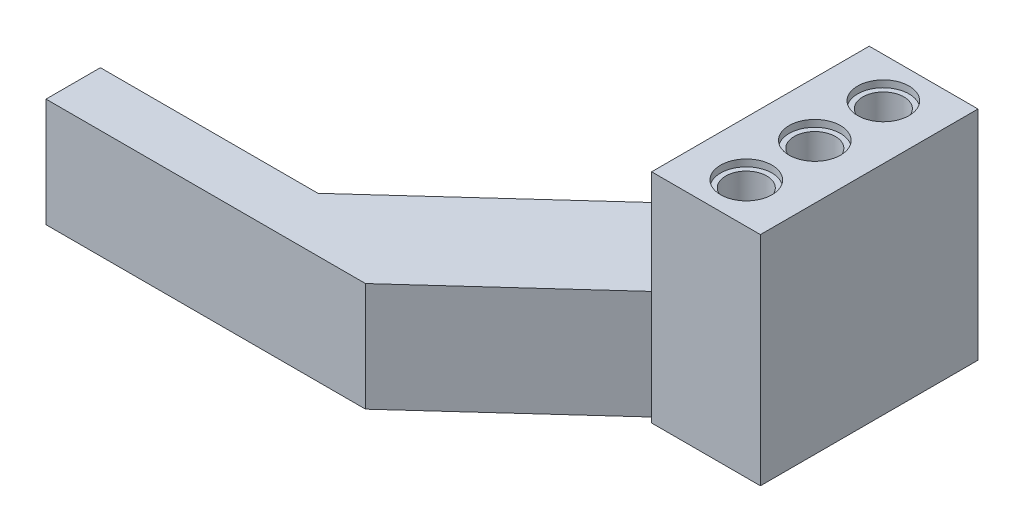
from build123d import *

# Parameters (mm, degrees)
SKETCH6_W           = 12.7
SKETCH6_H           = 25.4
BOSS_EXTRUDE1_DEPTH = 25.4
SKETCH7_R           = 3
SKETCH7_R_2         = 2.4
CUT_EXTRUDE1_DEPTH  = 0.8
SKETCH7_3_R         = 2.4
CUT_EXTRUDE2_DEPTH  = 7.2
SKETCH9_R           = 3
CUT_EXTRUDE4_DEPTH  = 0.8
BOSS_EXTRUDE3_DEPTH = 12.7


with BuildPart() as part:
    # Sketch6 → Boss-Extrude1 (new body)
    with BuildSketch(Plane(origin=(0, 0, 0), x_dir=(1, 0, 0), z_dir=(0, 1, 0))):
        Rectangle(SKETCH6_W, SKETCH6_H)
    extrude(amount=-BOSS_EXTRUDE1_DEPTH)

    # Sketch7 → Cut-Extrude1 (cut)
    # profile 1 of 3: a face of its own
    with BuildSketch(Plane(origin=(0, 0, 0), x_dir=(1, 0, 0), z_dir=(0, 1, 0))):
        with Locations((0, 8)):
            Circle(SKETCH7_R)
        with Locations((0, 8)):
            Circle(SKETCH7_R_2, mode=Mode.SUBTRACT)
    # profile 2 of 3: a face of its own
    with BuildSketch(Plane(origin=(0, 0, 0), x_dir=(1, 0, 0), z_dir=(0, 1, 0))):
        Circle(SKETCH7_R)
        Circle(SKETCH7_R_2, mode=Mode.SUBTRACT)
    # profile 3 of 3: a face of its own
    with BuildSketch(Plane(origin=(0, 0, 0), x_dir=(1, 0, 0), z_dir=(0, 1, 0))):
        with Locations((0, -8)):
            Circle(SKETCH7_R)
        with Locations((0, -8)):
            Circle(SKETCH7_R_2, mode=Mode.SUBTRACT)
    extrude(amount=-CUT_EXTRUDE1_DEPTH, mode=Mode.SUBTRACT)

    # Sketch7<3> → Cut-Extrude2 (cut)
    with BuildSketch(Plane(origin=(0, 0, 0), x_dir=(1, 0, 0), z_dir=(0, 1, 0))):
        with Locations((0, 8)):
            Circle(SKETCH7_3_R)
        Circle(SKETCH7_3_R)
        with Locations((0, -8)):
            Circle(SKETCH7_3_R)
    extrude(amount=-CUT_EXTRUDE2_DEPTH, mode=Mode.SUBTRACT)

    # Sketch9 → Cut-Extrude4 (cut)
    with BuildSketch(Plane(origin=(0, -7.2, -7.2), x_dir=(1, 0, 0), z_dir=(0, 1, 0))):
        with Locations((0, 0.8)):
            Circle(SKETCH9_R)
        with Locations((0, -7.2)):
            Circle(SKETCH9_R)
        with Locations((0, -15.2)):
            Circle(SKETCH9_R)
    extrude(amount=-CUT_EXTRUDE4_DEPTH, mode=Mode.SUBTRACT)

    # Sketch10 → Boss-Extrude3 (add)
    with BuildSketch(Plane(origin=(0, -25.4, 0), x_dir=(-1, 0, 0), z_dir=(0, -1, 0))):
        Polygon((6.35, 5.618661066), (36.35, -21.64999988), (61.75, -21.64999988), (61.75, -27.99999988), (24.454592791, -27.99999988), (-6.35, 0), align=None)
    extrude(amount=-BOSS_EXTRUDE3_DEPTH)


solid = part.part
